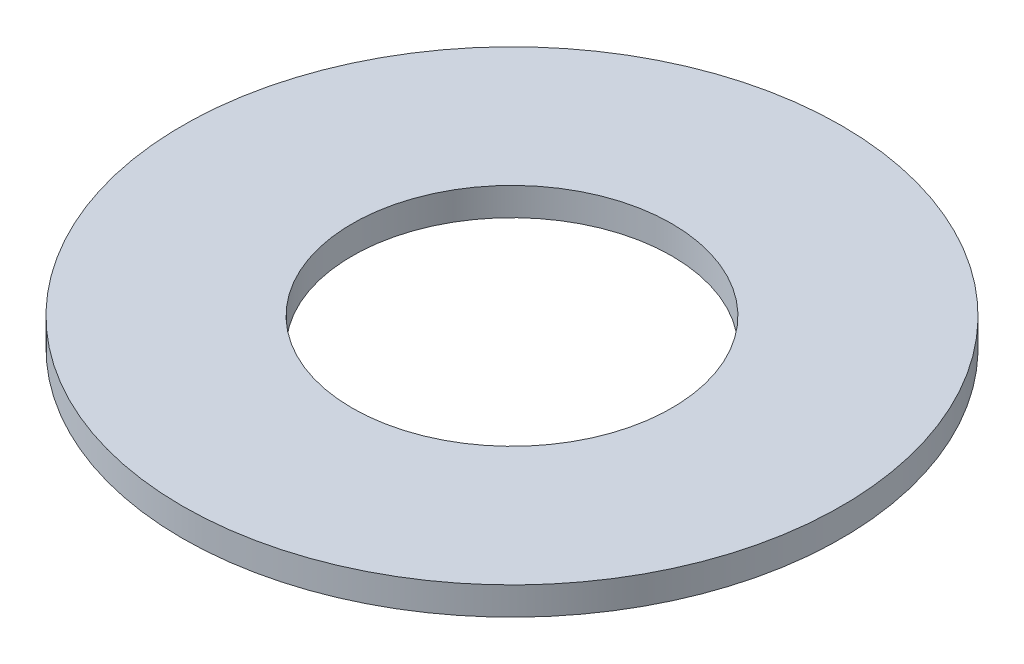
from build123d import *

# Parameters (mm, degrees)
SKETCH1_R           = 82.5
BOSS_EXTRUDE1_DEPTH = 7
SKETCH2_R           = 40
CUT_EXTRUDE1_DEPTH  = 117.882419551


with BuildPart() as part:
    # Sketch1 → Boss-Extrude1 (new body)
    with BuildSketch(Plane(origin=(0, 0, 0), x_dir=(1, 0, 0), z_dir=(0, 1, 0))):
        Circle(SKETCH1_R)
    extrude(amount=BOSS_EXTRUDE1_DEPTH)

    # Sketch2 → Cut-Extrude1 (cut, through all)
    with BuildSketch(Plane(origin=(0, 0, 0), x_dir=(1, 0, 0), z_dir=(0, 1, 0))):
        Circle(SKETCH2_R)
    extrude(amount=CUT_EXTRUDE1_DEPTH, mode=Mode.SUBTRACT)


solid = part.part
